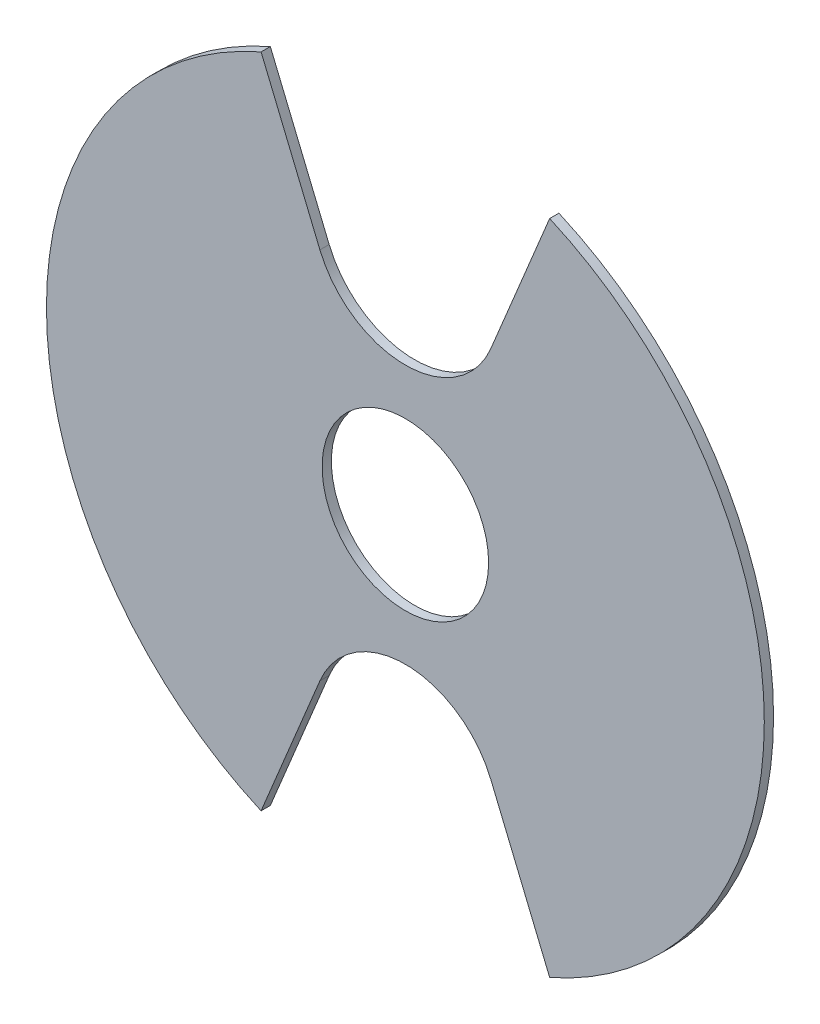
from build123d import *

# Parameters (mm, degrees)
ESQUISSE1_R             = 97
ESQUISSE1_R_2           = 22.5
MAIN_DEPTH              = 2.5
ENL_V_MAT_EXTRU_1_DEPTH = 138.201494161


with BuildPart() as part:
    # Esquisse1 → Main (new body)
    with BuildSketch(Plane.XY):
        Circle(ESQUISSE1_R)
        Circle(ESQUISSE1_R_2, mode=Mode.SUBTRACT)
    extrude(amount=MAIN_DEPTH)

    # Esquisse2 → Enlèv. mat.-Extru.1 (cut, symmetric)
    with BuildSketch(Plane.XY.offset(2.5)):
        with BuildLine():
            Line((219.060870494, 523.531576288), (38.995875853, 88.816224117))
            Line((38.995875853, 88.816224117), (23.096988313, 50.432914191))
            ThreePointArc((23.096988313, 50.432914191), (0, 35), (-23.096988313, 50.432914191))
            Line((-23.096988313, 50.432914191), (-38.995875853, 88.816224117))
            Line((-38.995875853, 88.816224117), (-219.060870494, 523.531576288))
            Line((-219.060870494, 523.531576288), (-219.060870494, 1464.596589361))
            Line((-219.060870494, 1464.596589361), (219.060870494, 1464.596589361))
            Line((219.060870494, 1464.596589361), (219.060870494, 523.531576288))
        make_face()
    enl_v_mat_extru_1 = extrude(amount=ENL_V_MAT_EXTRU_1_DEPTH, both=True, mode=Mode.SUBTRACT)

    # Symétrie1: Enlèv. mat.-Extru.1 across plane
    add(enl_v_mat_extru_1.mirror(Plane.ZX), mode=Mode.SUBTRACT)


solid = part.part
